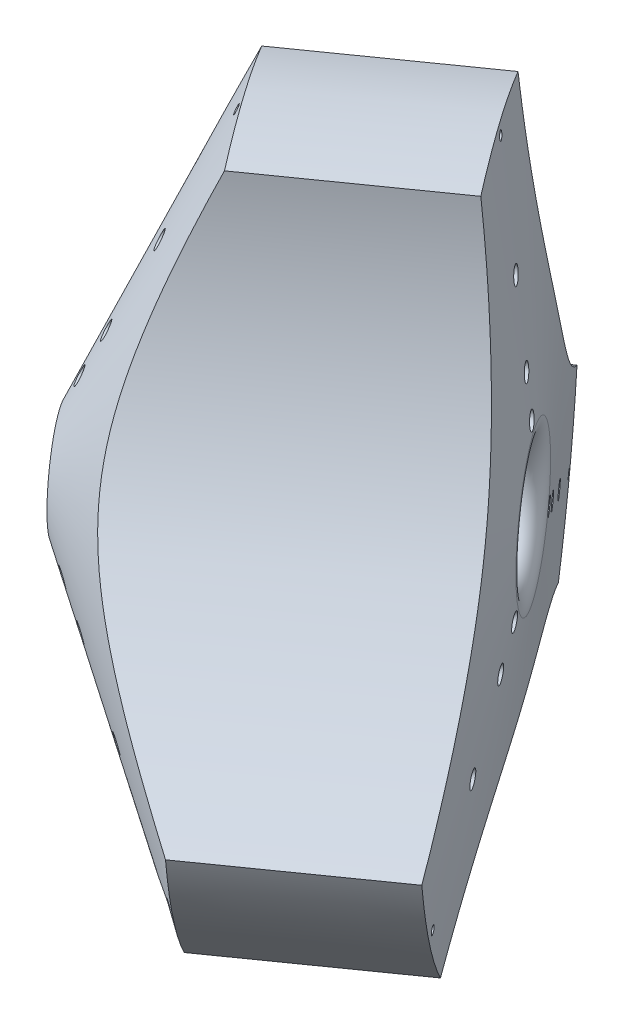
from build123d import *

# Parameters (mm, degrees)
SKETCH_2_R               = 2
SKETCH_2_R_2             = 1
SKETCH_2_R_3             = 122.5
SKETCH_2_R_4             = 12.5
CUT_EXTRUDE_1_DEPTH      = 97
FILLET_1_R               = 4.5
SHELL_1_T                = 2
SKETCH_4_W               = 72.616529218
SKETCH_4_H               = 2.421991527
EXTRUDE_1_DEPTH          = 0.5
PATTERN_CIRCULAR_1_COUNT = 3


with BuildPart() as part:
    # 草图1 → 旋转1 (revolve)
    with BuildSketch(Plane(origin=(0, 0, 0), x_dir=(1, 0, 0), z_dir=(0, 1, 0))):
        Polygon((-40.225978432, 69.673439355), (-76.021732743, 131.673505342), (-144.414589655, 83.377804323), (-76.41521075, 44.118343613), align=None)
    revolve(axis=Axis((-153.952509273, 0, -88.884524921), (0.8168643670415179, 0, -0.5768297893294524)))

    # 草图2 → 切除-拉伸1 (cut)
    with BuildSketch(Plane(origin=(11.31663942, 0, -7.99125901), x_dir=(-0.5768297893294532, 0, -0.8168643670415174), z_dir=(0.8168643670415174, 0, -0.5768297893294532))):
        with Locations((161.41099468, 50)):
            Circle(SKETCH_2_R)
        with Locations((161.41099468, 30)):
            Circle(SKETCH_2_R)
        with Locations((161.41099468, 20)):
            Circle(SKETCH_2_R)
        with Locations((161.41099468, 78.793702078)):
            Circle(SKETCH_2_R_2)
        with Locations((20.248853863, 81.5)):
            Circle(SKETCH_2_R_3)
        with Locations((302.573135497, 81.5)):
            Circle(SKETCH_2_R_3)
        with Locations((229.648342338, -39.396851039)):
            Circle(SKETCH_2_R_2)
        with Locations((187.391756794, -15)):
            Circle(SKETCH_2_R)
        with Locations((178.731502756, -10)):
            Circle(SKETCH_2_R)
        with Locations((161.41099468, -163)):
            Circle(SKETCH_2_R_3)
        with Locations((93.173647023, -39.396851039)):
            Circle(SKETCH_2_R_2)
        with Locations((135.430232567, -15)):
            Circle(SKETCH_2_R)
        with Locations((144.090486605, -10)):
            Circle(SKETCH_2_R)
        with Locations((204.71226487, -25)):
            Circle(SKETCH_2_R)
        with Locations((118.109724491, -25)):
            Circle(SKETCH_2_R)
        with Locations((161.41099468, 0)):
            Circle(SKETCH_2_R_4)
    extrude(amount=-CUT_EXTRUDE_1_DEPTH, mode=Mode.SUBTRACT)

    # 圆角1
    fillet_1_edges = [part.edges().sort_by_distance(p)[0] for p in [
        (-81.976883636, 12.5, -139.710202534),
    ]]
    fillet(fillet_1_edges, radius=FILLET_1_R)

    # 抽壳1 (no face opened: a closed hollow body)
    add(offset(amount=-SHELL_1_T, mode=Mode.PRIVATE), mode=Mode.SUBTRACT)

    # 草图4 → 凸台-拉伸1 (add, symmetric)
    with BuildSketch(Plane(origin=(-93.106670057, 0, -131.850890003), x_dir=(-0.8168643670415173, 0, 0.5768297893294533), z_dir=(-0.5768297893294533, 0, -0.8168643670415173))):
        Polygon((-11.725244005, 16.520977143), (65.213349961, 16.520977143), (66.598619351, 13.870411525), (-10.936678595, 13.870411525), (-11.725244005, 15.379247553), align=None)
        with Locations((25.270191149, 25.003032588)):
            Rectangle(SKETCH_4_W, SKETCH_4_H)
        Polygon((-8.539556939, 53.456929763), (47.825635767, 53.456929763), (38.116123689, 76.548842309), (-6.66584632, 76.548842309), align=None)
    extrude_1 = extrude(amount=EXTRUDE_1_DEPTH, both=True)

    # 阵列(圆周)1: 凸台-拉伸1 ×3 about axis
    pattern_circular_1_axis = Axis((-128.497598476, 0, -106.859541858), (0.8168643670415175, 0, -0.576829789329453))
    for i in range(1, PATTERN_CIRCULAR_1_COUNT):
        add(extrude_1.rotate(pattern_circular_1_axis, i * 360 / PATTERN_CIRCULAR_1_COUNT))


solid = part.part
